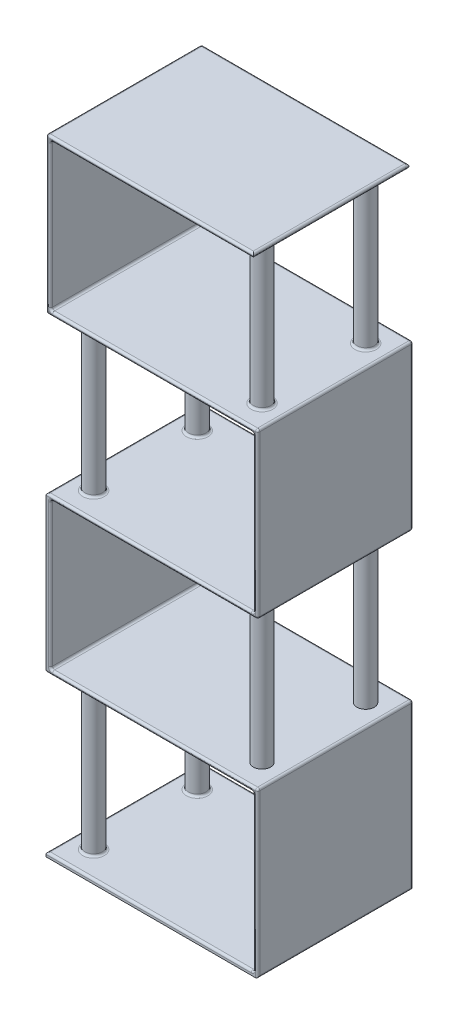
from build123d import *

# Parameters (mm, degrees)
BOSS_EXTRUDE1_DEPTH = 228.6
BOSS_EXTRUDE2_REACH = 1947.257
SKETCH2_R           = 25.4
LPATTERN1_COUNT     = 2
LPATTERN1_PITCH     = 914.4
BOSS_EXTRUDE3_REACH = 1513.994
SKETCH3_R           = 25.4
LPATTERN2_COUNT     = 2
LPATTERN2_PITCH     = 914.4
FILLET1_R           = 6.35


with BuildPart() as part:
    # Sketch1 → Boss-Extrude1 (new, symmetric)
    with BuildSketch(Plane.XY):
        Polygon((0, 0), (609.6, 0), (609.6, 457.2), (0, 457.2), (0, 914.4), (609.6, 914.4), (609.6, 1371.6), (0, 1371.6), (0, 1828.8), (609.6, 1828.8), (609.6, 1816.1), (12.7, 1816.1), (12.7, 1384.3), (622.3, 1384.3), (622.3, 901.7), (12.7, 901.7), (12.7, 469.9), (622.3, 469.9), (622.3, -12.7), (0, -12.7), align=None)
    extrude(amount=BOSS_EXTRUDE1_DEPTH, both=True)

    # Sketch2 → Boss-Extrude2 (add, up to next)
    with BuildSketch(Plane(origin=(0, 0, 0), x_dir=(1, 0, 0), z_dir=(0, 1, 0)), mode=Mode.PRIVATE) as boss_extrude2_sk1:
        with Locations(Location((63.5, 152.4, 0), (0, 0, 90))):
            Circle(SKETCH2_R)
    boss_extrude2_tool1 = extrude(boss_extrude2_sk1.sketch, amount=BOSS_EXTRUDE2_REACH, mode=Mode.PRIVATE) - part.part
    # Sketch2 → Boss-Extrude2 (add, up to next)
    with BuildSketch(Plane(origin=(0, 0, 0), x_dir=(1, 0, 0), z_dir=(0, 1, 0)), mode=Mode.PRIVATE) as boss_extrude2_sk2:
        with Locations(Location((63.5, -152.4, 0), (0, 0, 90))):
            Circle(SKETCH2_R)
    boss_extrude2_tool2 = extrude(boss_extrude2_sk2.sketch, amount=BOSS_EXTRUDE2_REACH, mode=Mode.PRIVATE) - part.part
    boss_extrude2_1 = boss_extrude2_tool1.solids().sort_by_distance((63.5, 0, -152.4))[0]
    add(boss_extrude2_1)
    boss_extrude2_2 = boss_extrude2_tool2.solids().sort_by_distance((63.5, 0, 152.4))[0]
    add(boss_extrude2_2)
    boss_extrude2 = boss_extrude2_1 + boss_extrude2_2  # Boss-Extrude2 as one shape, for the pattern or mirror that repeats it

    # LPattern1: Boss-Extrude2 ×2
    with Locations(*[(0, i * LPATTERN1_PITCH, 0) for i in range(1, LPATTERN1_COUNT)]):
        add(boss_extrude2)

    # Sketch3 → Boss-Extrude3 (add, up to next)
    with BuildSketch(Plane(origin=(0, 469.9, 0), x_dir=(1, 0, 0), z_dir=(0, 1, 0)), mode=Mode.PRIVATE) as boss_extrude3_sk1:
        with Locations((558.8, 152.4)):
            Circle(SKETCH3_R)
    boss_extrude3_tool1 = extrude(boss_extrude3_sk1.sketch, amount=BOSS_EXTRUDE3_REACH, mode=Mode.PRIVATE) - part.part
    # Sketch3 → Boss-Extrude3 (add, up to next)
    with BuildSketch(Plane(origin=(0, 469.9, 0), x_dir=(1, 0, 0), z_dir=(0, 1, 0)), mode=Mode.PRIVATE) as boss_extrude3_sk2:
        with Locations((558.8, -152.4)):
            Circle(SKETCH3_R)
    boss_extrude3_tool2 = extrude(boss_extrude3_sk2.sketch, amount=BOSS_EXTRUDE3_REACH, mode=Mode.PRIVATE) - part.part
    boss_extrude3_1 = boss_extrude3_tool1.solids().sort_by_distance((558.8, 469.9, -152.4))[0]
    add(boss_extrude3_1)
    boss_extrude3_2 = boss_extrude3_tool2.solids().sort_by_distance((558.8, 469.9, 152.4))[0]
    add(boss_extrude3_2)
    boss_extrude3 = boss_extrude3_1 + boss_extrude3_2  # Boss-Extrude3 as one shape, for the pattern or mirror that repeats it

    # LPattern2: Boss-Extrude3 ×2
    with Locations(*[(0, i * LPATTERN2_PITCH, 0) for i in range(1, LPATTERN2_COUNT)]):
        add(boss_extrude3)

    # Fillet1
    fillet1_edges = [part.edges().sort_by_distance(p)[0] for p in [
        (609.6, 228.6, 228.6),
        (609.6, 228.6, -228.6),
        (317.5, 469.9, 228.6),
        (317.5, 469.9, -228.6),
        (609.6, 1143, 228.6),
        (609.6, 1143, -228.6),
        (12.7, 1600.2, 228.6),
        (12.7, 1600.2, -228.6),
        (622.3, -12.7, 0),
        (622.3, 228.6, 228.6),
        (622.3, 469.9, 0),
        (622.3, 228.6, -228.6),
        (609.6, 0, 0),
        (304.8, 0, 228.6),
        (0, 0, 0),
        (304.8, 0, -228.6),
        (63.5, 0, -127),
        (63.5, 0, 177.8),
        (0, 457.2, 0),
        (304.8, 457.2, 228.6),
        (609.6, 457.2, 0),
        (304.8, 457.2, -228.6),
        (63.5, 457.2, -127),
        (63.5, 457.2, 177.8),
        (12.7, 469.9, 0),
        (12.7, 685.8, 228.6),
        (12.7, 685.8, -228.6),
        (12.7, 901.7, 0),
        (317.5, 901.7, 228.6),
        (317.5, 901.7, -228.6),
        (533.4, 901.7, -152.4),
        (533.4, 901.7, 152.4),
        (304.8, 1371.6, 228.6),
        (609.6, 1371.6, 0),
        (304.8, 1371.6, -228.6),
        (63.5, 1371.6, -127),
        (63.5, 1371.6, 177.8),
        (0, 1600.2, 228.6),
        (0, 1371.6, 0),
        (0, 1600.2, -228.6),
        (622.3, 901.7, 0),
        (622.3, 1143, 228.6),
        (622.3, 1143, -228.6),
        (609.6, 914.4, 0),
        (304.8, 914.4, 228.6),
        (0, 914.4, 0),
        (304.8, 914.4, -228.6),
        (63.5, 914.4, -127),
        (63.5, 914.4, 177.8),
        (622.3, 1384.3, 0),
        (317.5, 1384.3, 228.6),
        (12.7, 1384.3, 0),
        (317.5, 1384.3, -228.6),
        (533.4, 1384.3, -152.4),
        (533.4, 1384.3, 152.4),
        (12.7, 1816.1, 0),
        (311.15, 1816.1, 228.6),
        (609.6, 1816.1, 0),
        (311.15, 1816.1, -228.6),
        (533.4, 1816.1, -152.4),
        (533.4, 1816.1, 152.4),
        (609.6, 1828.8, 0),
        (304.8, 1828.8, 228.6),
        (0, 1828.8, 0),
        (304.8, 1828.8, -228.6),
    ]]
    fillet(fillet1_edges, radius=FILLET1_R - 0.0001)  # a hair under: the kernel refuses the full size


solid = part.part
